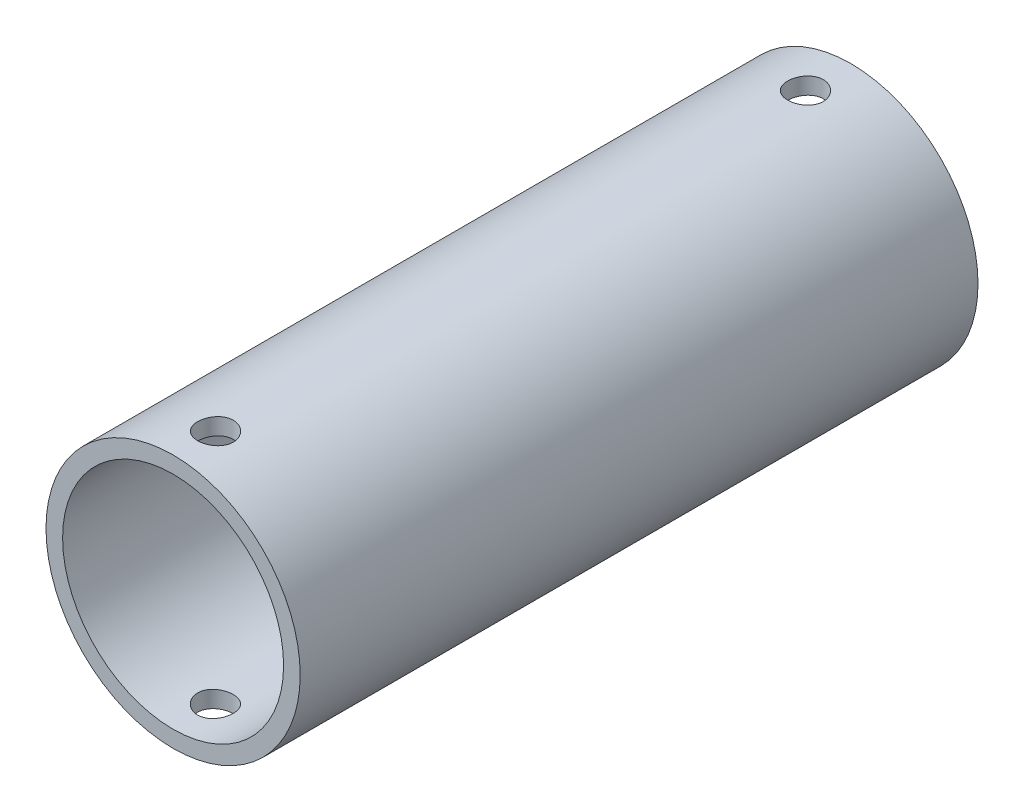
from build123d import *

# Parameters (mm, degrees)
SKETCH1_R               = 9.525
SKETCH1_R_2             = 8.2804
BOSS_EXTRUDE1_DEPTH     = 50.8
CUT_EXTRUDE1_DEPTH      = 53.555601509
CUT_EXTRUDE1_DEPTH_BACK = 53.555601509
SKETCH2_R               = 1.3335


with BuildPart() as part:
    # Sketch1 → Boss-Extrude1 (new body)
    with BuildSketch(Plane.XY):
        Circle(SKETCH1_R)
        Circle(SKETCH1_R_2, mode=Mode.SUBTRACT)
    extrude(amount=BOSS_EXTRUDE1_DEPTH)

    # Sketch2 → Cut-Extrude1 (cut, two sides: drawn at the far end of the back side and taken through both)
    with BuildSketch(Plane(origin=(0, 0, 0), x_dir=(1, 0, 0), z_dir=(0, 1, 0)).offset(-CUT_EXTRUDE1_DEPTH_BACK)):
        with Locations((0, -47.625)):
            Circle(SKETCH2_R)
        with Locations((0, -3.407603683)):
            Circle(SKETCH2_R)
    extrude(amount=CUT_EXTRUDE1_DEPTH + CUT_EXTRUDE1_DEPTH_BACK, mode=Mode.SUBTRACT)


solid = part.part
